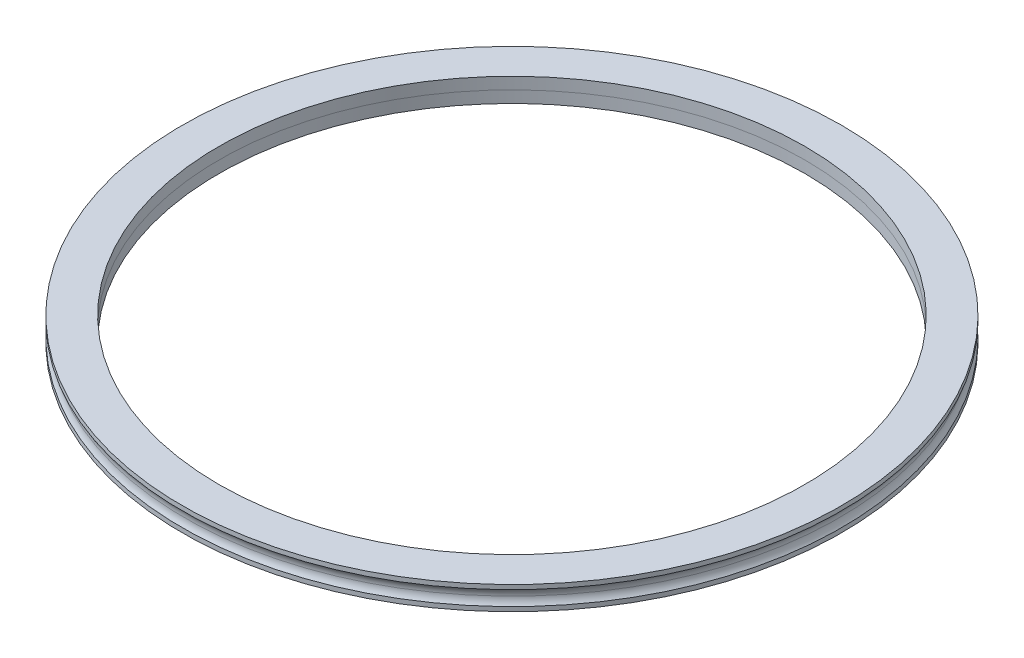
from build123d import *


with BuildPart() as part:
    # Sketch1 → Revolve1 (revolve)
    with BuildSketch(Plane.XY):
        with BuildLine():
            Line((-67.5, 12.0475), (-67.5, 12.9625))
            Line((-67.5, 12.9625), (-60, 12.9625))
            Line((-60, 12.9625), (-60, 8.1325))
            Line((-60, 8.1325), (-67.5, 8.1325))
            Line((-67.5, 8.1325), (-67.5, 9.0475))
            ThreePointArc((-67.5, 9.0475), (-67, 10.5475), (-67.5, 12.0475))
        make_face()
    revolve(axis=Axis((0, -200069.047495165, 0), (0, 1, 0)))


with BuildPart() as body_2:
    # Split1: the piece on the far side of the plane
    add(part.part)
    split(bisect_by=Plane.ZX.offset(10.5475), keep=Keep.BOTTOM)


with BuildPart() as part_1:
    add(part.part)

    # Split1
    split(bisect_by=Plane.ZX.offset(10.5475), keep=Keep.TOP)


solid = Compound([body_2.part, part_1.part])
